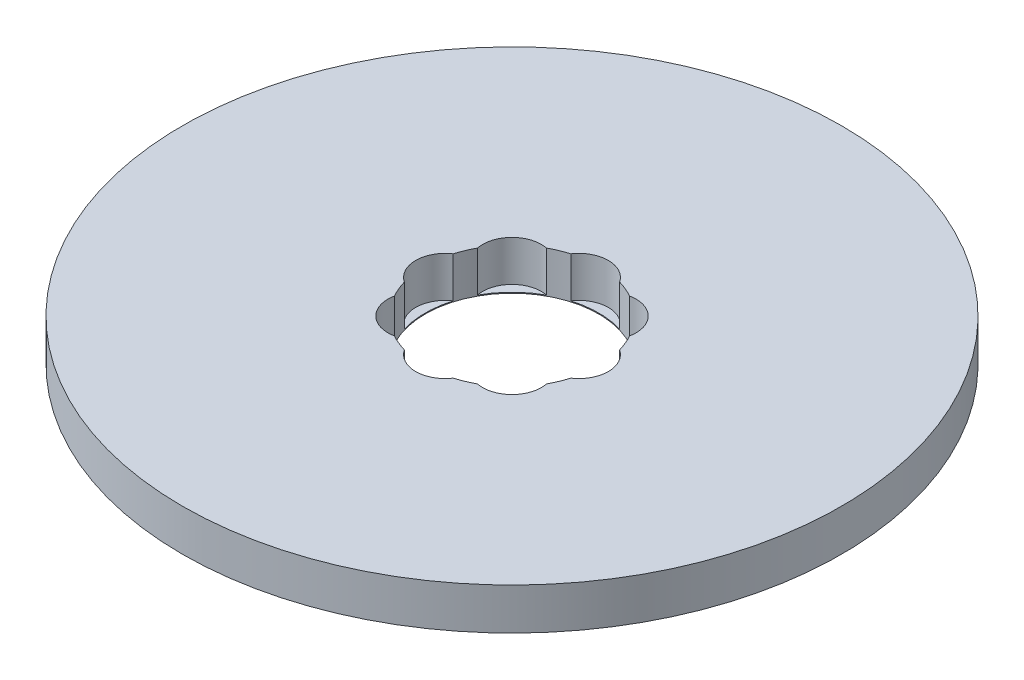
from build123d import *

# Parameters (mm, degrees)
SKETCH1_R           = 95
BOSS_EXTRUDE1_DEPTH = 12
SKETCH2_R           = 25
CUT_EXTRUDE1_DEPTH  = 135.88513632
SKETCH3_R           = 8.457473765
CUT_EXTRUDE2_DEPTH  = 11.748282376
CIRPATTERN1_COUNT   = 8


with BuildPart() as part:
    # Sketch1 → Boss-Extrude1 (new body)
    with BuildSketch(Plane(origin=(0, 0, 0), x_dir=(1, 0, 0), z_dir=(0, 1, 0))):
        Circle(SKETCH1_R)
    extrude(amount=BOSS_EXTRUDE1_DEPTH)

    # Sketch2 → Cut-Extrude1 (cut, through all)
    with BuildSketch(Plane(origin=(0, 0, 0), x_dir=(1, 0, 0), z_dir=(0, 1, 0))):
        Circle(SKETCH2_R)
    extrude(amount=CUT_EXTRUDE1_DEPTH, mode=Mode.SUBTRACT)

    # Sketch3 → Cut-Extrude2 (cut)
    with BuildSketch(Plane(origin=(0, 12, 0), x_dir=(1, 0, 0), z_dir=(0, 1, 0))):
        with Locations((-19.300211782, 0)):
            Circle(SKETCH3_R)
    cut_extrude2 = extrude(amount=-CUT_EXTRUDE2_DEPTH, mode=Mode.SUBTRACT)

    # CirPattern1: Cut-Extrude2 ×8 about axis
    cirpattern1_axis = Axis((0, 0, 0), (0, 1, 0))
    for i in range(1, CIRPATTERN1_COUNT):
        add(cut_extrude2.rotate(cirpattern1_axis, i * 360 / CIRPATTERN1_COUNT), mode=Mode.SUBTRACT)


solid = part.part
